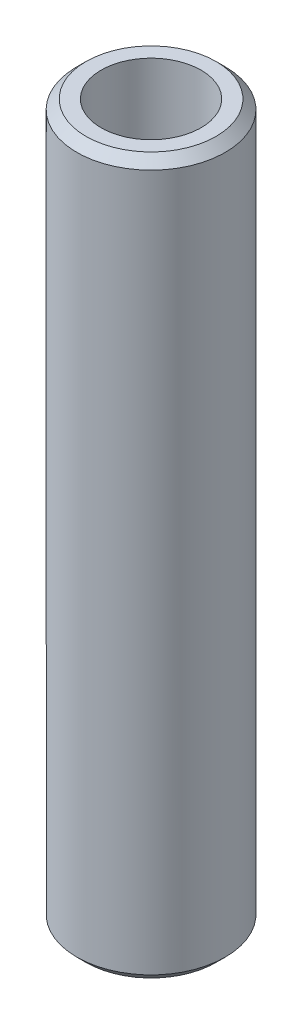
from build123d import *

# Parameters (mm, degrees)
SKETCH1_R           = 17.5
BOSS_EXTRUDE1_DEPTH = 168.730452131
SKETCH2_R           = 11.788079347
CUT_EXTRUDE1_DEPTH  = 171.535818749
CHAMFER1_SIZE       = 2.176825906


with BuildPart() as part:
    # Sketch1 → Boss-Extrude1 (new body)
    with BuildSketch(Plane(origin=(0, 0, 0), x_dir=(1, 0, 0), z_dir=(0, 1, 0))):
        Circle(SKETCH1_R)
    extrude(amount=BOSS_EXTRUDE1_DEPTH)

    # Sketch2 → Cut-Extrude1 (cut, through all)
    with BuildSketch(Plane(origin=(0, 0, 0), x_dir=(1, 0, 0), z_dir=(0, 1, 0))):
        Circle(SKETCH2_R)
    extrude(amount=CUT_EXTRUDE1_DEPTH, mode=Mode.SUBTRACT)

    # Chamfer1
    chamfer1_edges = [part.edges().sort_by_distance(p)[0] for p in [
        (-17.5, 168.730452131, 0),
        (-17.5, 0, 0),
    ]]
    chamfer(chamfer1_edges, length=CHAMFER1_SIZE)


solid = part.part
